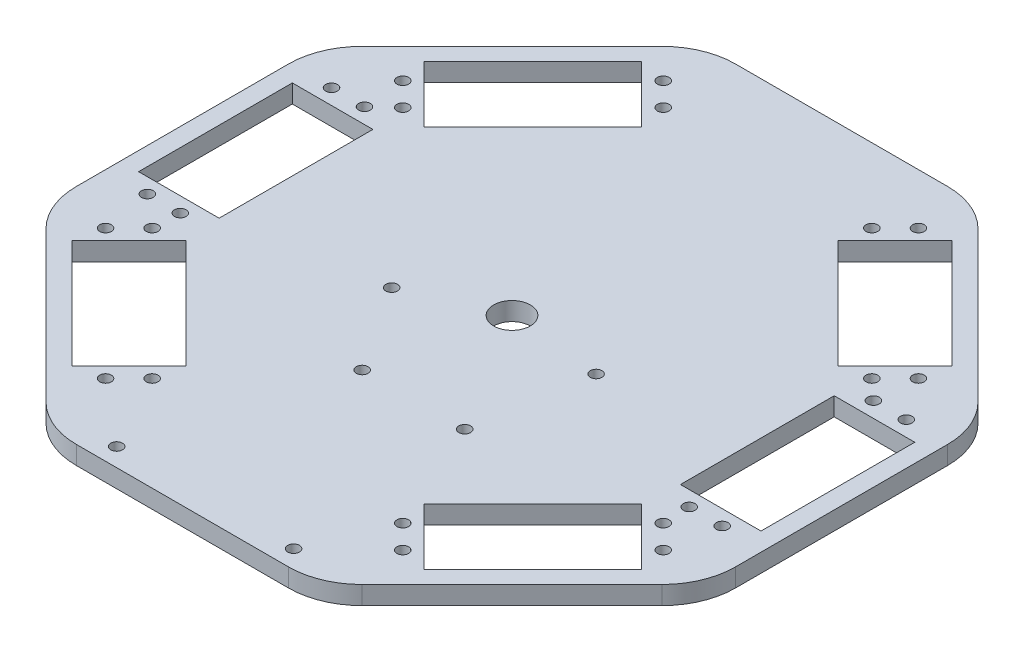
from build123d import *

# Parameters (mm, degrees)
BASEPLATE_DEPTH           = 5
FILLET1_R                 = 20
SKETCH2_W                 = 22
SKETCH2_H                 = 42
SKETCH2_R                 = 1.6
SERVO_HOLE_DEPTH          = 128.377392029
SKETCH3_R                 = 5
CENTER_HOLE_DEPTH         = 128.377392029
SERVO_HOLE_PATTERN_COUNT  = 8
SKETCH4_R                 = 1.6
ARDUINO_SCREW_HOLES_DEPTH = 128.377392029
MIRROR1_COPY_1_SKETCH_W   = 22
MIRROR1_COPY_1_SKETCH_H   = 42
MIRROR1_COPY_1_SKETCH_R   = 1.6
MIRROR1_COPY_1_DEPTH      = 128.377392029
MIRROR1_COPY_2_SKETCH_W   = 22
MIRROR1_COPY_2_SKETCH_H   = 42
MIRROR1_COPY_2_SKETCH_R   = 1.6
MIRROR1_COPY_2_DEPTH      = 128.377392029


with BuildPart() as part:
    # Sketch1 → Baseplate (new body)
    with BuildSketch(Plane(origin=(0, 0, 0), x_dir=(1, 0, 0), z_dir=(0, 1, 0))):
        Polygon((-90, 37.279220614), (-90, -37.279220614), (-37.279220614, -90), (37.279220614, -90), (90, -37.279220614), (90, 37.279220614), (37.279220614, 90), (-37.279220614, 90), align=None)
    extrude(amount=BASEPLATE_DEPTH)

    # Fillet1
    fillet1_edges = [part.edges().sort_by_distance(p)[0] for p in [
        (-90, 2.5, -37.279220614),
        (-37.279220614, 2.5, -90),
        (37.279220614, 2.5, -90),
        (90, 2.5, -37.279220614),
        (90, 2.5, 37.279220614),
        (37.279220614, 2.5, 90),
        (-37.279220614, 2.5, 90),
        (-90, 2.5, 37.279220614),
    ]]
    fillet(fillet1_edges, radius=FILLET1_R)

    # Sketch2 → Servo hole (cut, through all)
    with BuildSketch(Plane(origin=(0, 5, 0), x_dir=(1, 0, 0), z_dir=(0, 1, 0))):
        with Locations((74, 4.005050634)):
            Rectangle(SKETCH2_W, SKETCH2_H)
        with Locations((78.5, 29.205050634)):
            Circle(SKETCH2_R)
        with Locations((69.5, 29.205050634)):
            Circle(SKETCH2_R)
        with Locations((69.5, -21.094949366)):
            Circle(SKETCH2_R)
        with Locations((78.5, -21.094949366)):
            Circle(SKETCH2_R)
    servo_hole = extrude(amount=-SERVO_HOLE_DEPTH, mode=Mode.SUBTRACT)

    # Sketch3 → Center hole (cut, through all)
    with BuildSketch(Plane(origin=(0, 5, 0), x_dir=(1, 0, 0), z_dir=(0, 1, 0))):
        Circle(SKETCH3_R)
    extrude(amount=-CENTER_HOLE_DEPTH, mode=Mode.SUBTRACT)

    # Servo hole pattern: Servo hole ×8 about axis, 5 skipped
    servo_hole_pattern_axis = Axis((0, 5, 0), (0, 1, 0))
    add([servo_hole.rotate(servo_hole_pattern_axis, i * 360 / SERVO_HOLE_PATTERN_COUNT) for i in range(1, SERVO_HOLE_PATTERN_COUNT) if i not in (2, 3, 4, 5, 6)], mode=Mode.SUBTRACT)

    # Sketch4 → Arduino Screw holes (cut, through all)
    with BuildSketch(Plane(origin=(0, 5, 0), x_dir=(1, 0, 0), z_dir=(0, 1, 0))):
        with Locations((-23, -9.8668)):
            Circle(SKETCH4_R)
        with Locations((-23, -85)):
            Circle(SKETCH4_R)
        with Locations((25.3362, -2.3738)):
            Circle(SKETCH4_R)
        with Locations((25.3362, -85)):
            Circle(SKETCH4_R)
        with Locations((-7.55849277, -33.3745)):
            Circle(SKETCH4_R)
        with Locations((20.45770723, -33.3745)):
            Circle(SKETCH4_R)
    extrude(amount=-ARDUINO_SCREW_HOLES_DEPTH, mode=Mode.SUBTRACT)

    # Mirror1: Servo hole across plane
    add(servo_hole.mirror(Plane(origin=(0, 0, 0), x_dir=(0, 0, 1), z_dir=(1, 0, 0))), mode=Mode.SUBTRACT)

    # Mirror1 copy 1 sketch → Mirror1 copy 1 (cut, through all)
    with BuildSketch(Plane(origin=(0, 5, 0), x_dir=(-0.7071067811865476, 0, -0.7071067811865475), z_dir=(0, 1, 0))):
        with Locations((74, -4.005050634)):
            Rectangle(MIRROR1_COPY_1_SKETCH_W, MIRROR1_COPY_1_SKETCH_H)
        with Locations((78.5, -29.205050634)):
            Circle(MIRROR1_COPY_1_SKETCH_R)
        with Locations((69.5, -29.205050634)):
            Circle(MIRROR1_COPY_1_SKETCH_R)
        with Locations((69.5, 21.094949366)):
            Circle(MIRROR1_COPY_1_SKETCH_R)
        with Locations((78.5, 21.094949366)):
            Circle(MIRROR1_COPY_1_SKETCH_R)
    extrude(amount=-MIRROR1_COPY_1_DEPTH, mode=Mode.SUBTRACT)

    # Mirror1 copy 2 sketch → Mirror1 copy 2 (cut, through all)
    with BuildSketch(Plane(origin=(0, 5, 0), x_dir=(-0.7071067811865474, 0, 0.7071067811865477), z_dir=(0, 1, 0))):
        with Locations((74, -4.005050634)):
            Rectangle(MIRROR1_COPY_2_SKETCH_W, MIRROR1_COPY_2_SKETCH_H)
        with Locations((78.5, -29.205050634)):
            Circle(MIRROR1_COPY_2_SKETCH_R)
        with Locations((69.5, -29.205050634)):
            Circle(MIRROR1_COPY_2_SKETCH_R)
        with Locations((69.5, 21.094949366)):
            Circle(MIRROR1_COPY_2_SKETCH_R)
        with Locations((78.5, 21.094949366)):
            Circle(MIRROR1_COPY_2_SKETCH_R)
    extrude(amount=-MIRROR1_COPY_2_DEPTH, mode=Mode.SUBTRACT)


solid = part.part
